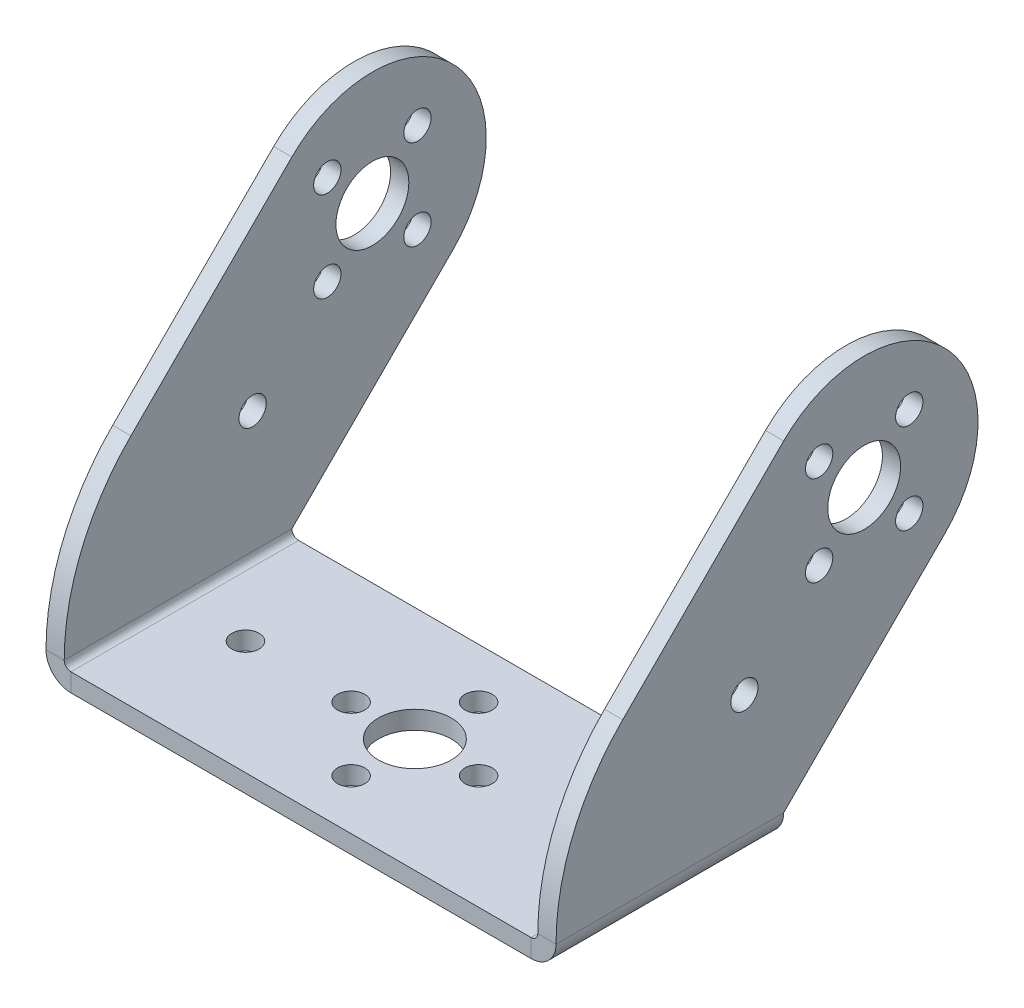
from build123d import *

# Parameters (mm, degrees)
SM_BASE_FLANGE_1_DEPTH   = 46.34
CUT_EXTRUDE_1_DEPTH      = 83.488760446
EXTRUDE_1_DEPTH          = 2
CUT_EXTRUDE_2_DEPTH      = 82.508925285
CUT_EXTRUDE_2_DEPTH_BACK = 82.508925285
SKETCH_9_R               = 4
SKETCH_9_R_2             = 1.5
SKETCH_10_R              = 4
SKETCH_10_R_2            = 1.5
CUT_EXTRUDE_3_DEPTH      = 2


# Sheet-metal steps are written as plain solids
with BuildPart() as part:
    # Sketch 1 → 基体-法兰1 (new body)
    with BuildSketch(Plane.XY):
        with BuildLine():
            Line((0, 39), (0, 0.7366))
            ThreePointArc((0, 0.7366), (0.215745145, 0.215745145), (0.7366, 0))
            Line((0.7366, 0), (51.2634, 0))
            ThreePointArc((51.2634, 0), (51.784254855, 0.215745145), (52, 0.7366))
            Line((52, 0.7366), (52, 39))
            Line((52, 39), (54, 39))
            Line((54, 39), (54, 0.7366))
            ThreePointArc((54, 0.7366), (53.198468417, -1.198468417), (51.2634, -2))
            Line((51.2634, -2), (0.7366, -2))
            ThreePointArc((0.7366, -2), (-1.198468417, -1.198468417), (-2, 0.7366))
            Line((-2, 0.7366), (-2, 39))
            Line((-2, 39), (0, 39))
        make_face()
    extrude(amount=SM_BASE_FLANGE_1_DEPTH)

    # 草图7 → 切除-拉伸1 (cut, through all)
    with BuildSketch(Plane.ZY.offset(2)):
        with BuildLine():
            ThreePointArc((46.34, 0.7366), (44.436988313, 10.303685809), (39.01766953, 18.41426953))
            Line((39.01766953, 18.41426953), (21.34, 36.091939059))
            Line((21.34, 36.091939059), (3.66233047, 18.41426953))
            Line((3.66233047, 18.41426953), (21.34, 0.7366))
            Line((21.34, 0.7366), (21.34, -3.161495831))
            Line((21.34, -3.161495831), (-1.543022836, -3.161495831))
            Line((-1.543022836, -3.161495831), (-1.543022836, 48.54205915))
            Line((-1.543022836, 48.54205915), (49.658153452, 48.54205915))
            Line((49.658153452, 48.54205915), (49.658153452, 0.7366))
            Line((49.658153452, 0.7366), (46.34, 0.7366))
        make_face()
    extrude(amount=-CUT_EXTRUDE_1_DEPTH, mode=Mode.SUBTRACT)

    # 草图8 → 凸台-拉伸1 (add)
    with BuildSketch(Plane.ZY.offset(2)):
        with BuildLine():
            Line((21.34, 36.091939059), (3.66233047, 18.41426953))
            ThreePointArc((3.66233047, 18.41426953), (3.66233047, 36.091939059), (21.34, 36.091939059))
        make_face()
    extrude_1 = extrude(amount=-EXTRUDE_1_DEPTH)

    # 镜向1: 凸台-拉伸1 across plane
    add(extrude_1.mirror(Plane(origin=(26, 0, 0), x_dir=(0, 0, 1), z_dir=(1, 0, 0))))

    # 草图9 → 切除-拉伸2 (cut, two sides: drawn at the far end of the back side and taken through both)
    with BuildSketch(Plane.ZY.offset(-52).offset(-CUT_EXTRUDE_2_DEPTH_BACK)):
        with Locations((12.501165235, 27.253104294)):
            Circle(SKETCH_9_R)
        with Locations((25.653351365, 14.100918164)):
            Circle(SKETCH_9_R_2)
        with Locations((7.551417767, 32.202851763)):
            Circle(SKETCH_9_R_2)
        with Locations((17.450912703, 32.202851763)):
            Circle(SKETCH_9_R_2)
        with Locations((17.450912703, 22.303356826)):
            Circle(SKETCH_9_R_2)
        with Locations((7.551417767, 22.303356826)):
            Circle(SKETCH_9_R_2)
    extrude(amount=CUT_EXTRUDE_2_DEPTH + CUT_EXTRUDE_2_DEPTH_BACK, mode=Mode.SUBTRACT)

    # 草图10 → 切除-拉伸3 (cut)
    with BuildSketch(Plane(origin=(0, 0, 0), x_dir=(1, 0, 0), z_dir=(0, 1, 0))):
        with Locations(Location((26, -33.84, 0), (0, 0, 270))):
            Circle(SKETCH_10_R)
        with Locations(Location((26, -26.84, 0), (0, 0, 270))):
            Circle(SKETCH_10_R_2)
        with Locations(Location((33, -33.84, 0), (0, 0, 270))):
            Circle(SKETCH_10_R_2)
        with Locations(Location((26, -40.84, 0), (0, 0, 270))):
            Circle(SKETCH_10_R_2)
        with Locations(Location((19, -33.84, 0), (0, 0, 270))):
            Circle(SKETCH_10_R_2)
        with Locations(Location((7.4, -33.84, 0), (0, 0, 270))):
            Circle(SKETCH_10_R_2)
        with Locations(Location((44.6, -33.84, 0), (0, 0, 270))):
            Circle(SKETCH_10_R_2)
    extrude(amount=-CUT_EXTRUDE_3_DEPTH, mode=Mode.SUBTRACT)


solid = part.part
